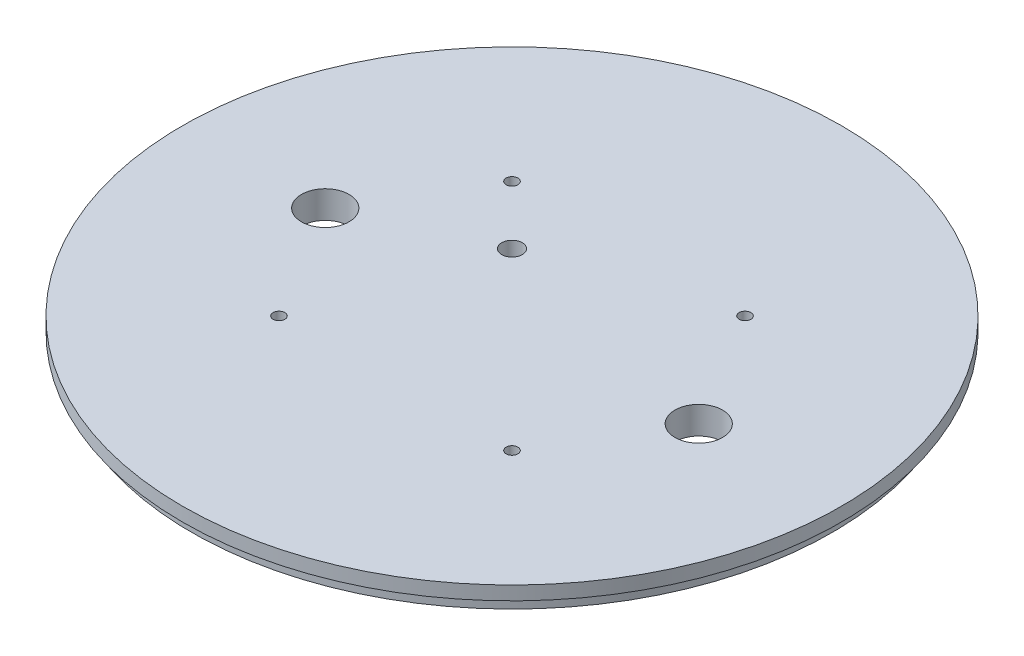
from build123d import *

# Parameters (mm, degrees)
SKETCH1_R           = 76.2
SKETCH1_R_2         = 1.3589
SKETCH1_R_3         = 5.500000049
SKETCH1_R_4         = 2.38125
BOSS_EXTRUDE1_DEPTH = 6.35
SKETCH2_R           = 76.2
SKETCH2_R_2         = 74.041
CUT_EXTRUDE1_DEPTH  = 3.175
CUT_EXTRUDE2_START  = -3.175
CUT_EXTRUDE2_DEPTH  = 3.556


with BuildPart() as part:
    # Sketch1 → Boss-Extrude1 (new body)
    with BuildSketch(Plane(origin=(0, 0, 0), x_dir=(1, 0, 0), z_dir=(0, 1, 0))):
        Circle(SKETCH1_R)
        with Locations((-26.940768363, -26.940768363)):
            Circle(SKETCH1_R_2, mode=Mode.SUBTRACT)
        with Locations((26.940768363, -26.940768363)):
            Circle(SKETCH1_R_2, mode=Mode.SUBTRACT)
        with Locations((-43.18, 0)):
            Circle(SKETCH1_R_3, mode=Mode.SUBTRACT)
        with Locations((-13.470384182, 13.470384182)):
            Circle(SKETCH1_R_4, mode=Mode.SUBTRACT)
        with Locations((-26.940768363, 26.940768363)):
            Circle(SKETCH1_R_2, mode=Mode.SUBTRACT)
        with Locations((26.940768363, 26.940768363)):
            Circle(SKETCH1_R_2, mode=Mode.SUBTRACT)
        with Locations((43.18, 0)):
            Circle(SKETCH1_R_3, mode=Mode.SUBTRACT)
    extrude(amount=BOSS_EXTRUDE1_DEPTH)

    # Sketch2 → Cut-Extrude1 (cut)
    with BuildSketch(Plane.XZ):
        Circle(SKETCH2_R)
        Circle(SKETCH2_R_2, mode=Mode.SUBTRACT)
    extrude(amount=-CUT_EXTRUDE1_DEPTH, mode=Mode.SUBTRACT)

    # Sketch3 → Cut-Extrude2 (cut)
    with BuildSketch(Plane(origin=(0, 6.35, 0), x_dir=(1, 0, 0), z_dir=(0, 1, 0)).offset(CUT_EXTRUDE2_START)):
        with BuildLine():
            Line((3.2385, 34.798), (3.2385, 13.97))
            ThreePointArc((3.2385, 13.97), (0, 10.7315), (-3.2385, 13.97))
            Line((-3.2385, 13.97), (-3.2385, 34.798))
            ThreePointArc((-3.2385, 34.798), (0, 38.0365), (3.2385, 34.798))
        make_face()
        with BuildLine():
            Line((3.2385, -34.798), (3.2385, -13.97))
            ThreePointArc((3.2385, -13.97), (0, -10.7315), (-3.2385, -13.97))
            Line((-3.2385, -13.97), (-3.2385, -34.798))
            ThreePointArc((-3.2385, -34.798), (0, -38.0365), (3.2385, -34.798))
        make_face()
    extrude(amount=-CUT_EXTRUDE2_DEPTH, mode=Mode.SUBTRACT)


solid = part.part
